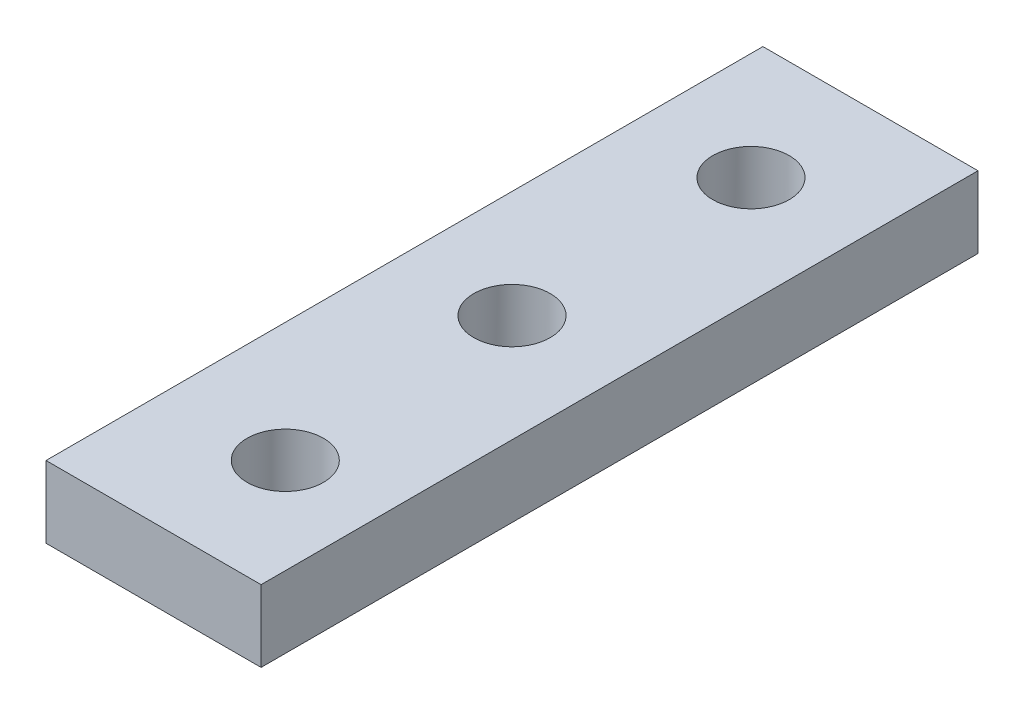
from build123d import *

# Parameters (mm, degrees)
ESQUISSE1_W                                          = 9
ESQUISSE1_H                                          = 3
BOSS_EXTRU_1_DEPTH                                   = 30
ESQUISSE4_R                                          = 1.6
ENL_V_MAT_EXTRU_1_DEPTH                              = 32.464265445
FORMSENKUNG_F_R_M2_SENKSCHRAUBE_MIT_SCHL_D           = 2.2
FORMSENKUNG_F_R_M2_SENKSCHRAUBE_MIT_SCHL_CSINK_D     = 4.4
FORMSENKUNG_F_R_M2_SENKSCHRAUBE_MIT_SCHL_CSINK_ANGLE = 90


with BuildPart() as part:
    # Esquisse1 → Boss.-Extru.1 (new body)
    with BuildSketch(Plane.XY):
        with Locations((4.5, 1.5)):
            Rectangle(ESQUISSE1_W, ESQUISSE1_H)
    extrude(amount=BOSS_EXTRU_1_DEPTH)

    # Esquisse4 → Enlèv. mat.-Extru.1 (cut, through all)
    with BuildSketch(Plane(origin=(0, 3, 0), x_dir=(1, 0, 0), z_dir=(0, 1, 0))):
        with Locations((4.5, -5)):
            Circle(ESQUISSE4_R)
        with Locations((4.5, -15)):
            Circle(ESQUISSE4_R)
        with Locations((5, -24.987492178)):
            Circle(ESQUISSE4_R)
    extrude(amount=-ENL_V_MAT_EXTRU_1_DEPTH, mode=Mode.SUBTRACT)

    # Formsenkung für M2 Senkschraube mit Schlitz/Kreuzschlitz1 (through all)
    with Locations(Plane(origin=(0, 0, 0), x_dir=(-1, 0, 0), z_dir=(0, -1, 0))):
        with Locations((-4.5, -5), (-4.5, -15)):
            CounterSinkHole(FORMSENKUNG_F_R_M2_SENKSCHRAUBE_MIT_SCHL_D / 2, FORMSENKUNG_F_R_M2_SENKSCHRAUBE_MIT_SCHL_CSINK_D / 2, counter_sink_angle=FORMSENKUNG_F_R_M2_SENKSCHRAUBE_MIT_SCHL_CSINK_ANGLE)


solid = part.part
